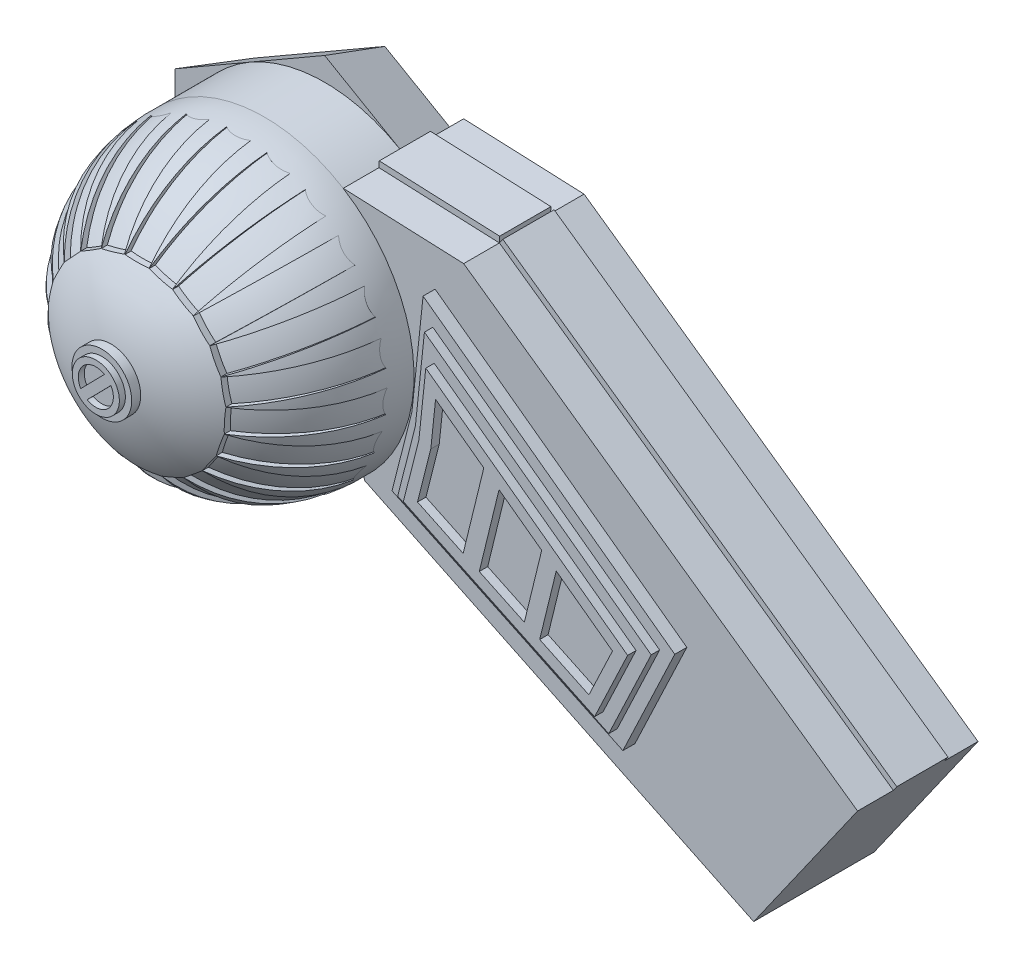
from build123d import *

# Parameters (mm, degrees)
BOSS_EXTRUDE8_DEPTH       = 25.4
SKETCH8_R                 = 31.562311244
BOSS_EXTRUDE4_DEPTH       = 12.7
SKETCH9_R                 = 6.296860476
BOSS_EXTRUDE5_DEPTH       = 59.69
SKETCH10_R                = 4.966059603
BOSS_EXTRUDE6_DEPTH       = 1.27
CUT_EXTRUDE3_REACH        = 176.634
CUT_EXTRUDE3_START_RADIUS = 31.594486539
CUT_EXTRUDE3_END_RADIUS   = 31.594486539
CIRPATTERN8_COUNT         = 23
CIRPATTERN8_ANGLE         = 344
SKETCH13_W                = 101.6
SKETCH13_H                = 10.805663742
BOSS_EXTRUDE9_DEPTH       = 1.27
BOSS_EXTRUDE10_DEPTH      = 2.54
BOSS_EXTRUDE11_DEPTH      = 1.778
BOSS_EXTRUDE12_DEPTH      = 1.778
SKETCH17_W                = 25.419527821
SKETCH17_H                = 10.805663742
BOSS_EXTRUDE13_DEPTH      = 1.27


# Read off the part's stored shape, not the designer's step: Dome2
with BuildPart() as part:
    # Sketch7 → Loft2 section 0
    with BuildSketch(Plane.XY.offset(12.7)):
        with BuildLine():
            Line((0, 36.445017786), (-31.562311244, 18.222508893))
            Line((-31.562311244, 18.222508893), (-31.562311244, -18.222508893))
            Line((-31.562311244, -18.222508893), (0, -36.445017786))
            Line((0, -36.445017786), (31.562311244, -18.222508893))
            Line((31.562311244, -18.222508893), (31.562311244, 18.222508893))
            Line((31.562311244, 18.222508893), (0, 36.445017786))
        make_face()
    # Sketch1 → Loft2 section 1
    with BuildSketch(Plane.XY):
        with BuildLine():
            Line((27.49630657, 15.875), (0, 31.75))
            Line((0, 31.75), (-27.49630657, 15.875))
            Line((-27.49630657, 15.875), (-27.49630657, -15.875))
            Line((-27.49630657, -15.875), (0, -31.75))
            Line((0, -31.75), (27.49630657, -15.875))
            Line((27.49630657, -15.875), (27.49630657, 15.875))
        make_face()
    loft()

    # Sketch8 → Boss-Extrude4 (add)
    with BuildSketch(Plane.XY.offset(12.7)):
        Circle(SKETCH8_R)
    extrude(amount=BOSS_EXTRUDE4_DEPTH)

    # Dome2 outline → Dome2 (revolve)
    with BuildSketch(Plane.XZ):
        with BuildLine():
            Line((0, 58.42), (0, 25.399999968))
            Line((0, 25.399999968), (31.562311242, 25.399999968))
            ThreePointArc((31.562311242, 25.399999968), (22.839110606, 48.656377081), (0, 58.42))
        make_face()
    revolve(axis=Axis((0, 0, 0), (0, 0, 1)))

    # Sketch9 → Boss-Extrude5 (add)
    with BuildSketch(Plane.XY):
        Circle(SKETCH9_R)
    extrude(amount=BOSS_EXTRUDE5_DEPTH)

    # Sketch10 → Boss-Extrude6 (add)
    with BuildSketch(Plane.XY.offset(59.69)):
        Circle(SKETCH10_R)
        with BuildLine():
            Line((1.821452192, 3.219670483), (-3.187259111, -1.877590334))
            ThreePointArc((-3.187259111, -1.877590334), (-2.638536355, 2.592699753), (1.821452192, 3.219670483))
        make_face(mode=Mode.SUBTRACT)
        with BuildLine():
            Line((3.187259111, 1.877590334), (-1.821452192, -3.219670483))
            ThreePointArc((-1.821452192, -3.219670483), (2.638536355, -2.592699753), (3.187259111, 1.877590334))
        make_face(mode=Mode.SUBTRACT)
    extrude(amount=BOSS_EXTRUDE6_DEPTH)

    # Cut-Extrude3: from a sphere face, 176.634 long prism both ways, kept between that surface and its translate by the depth
    cut_extrude3_start = Location((0, 0, 26.825513461)) * Sphere(CUT_EXTRUDE3_START_RADIUS, mode=Mode.PRIVATE)
    cut_extrude3_end = Location((0, 0, 25.555513461)) * Sphere(CUT_EXTRUDE3_END_RADIUS, mode=Mode.PRIVATE)
    # Sketch11 → Cut-Extrude3 (cut, from a surface)
    with BuildSketch(Plane.XY.offset(101.6), mode=Mode.PRIVATE) as cut_extrude3_sk1:
        Polygon((-2.54, 18.591821347), (0, 18.591821347), (2.54, 18.591821347), (2.54, 31.236508203), (-2.54, 31.236508203), align=None)
    cut_extrude3_tool1 = extrude(cut_extrude3_sk1.sketch, amount=CUT_EXTRUDE3_REACH, both=True, mode=Mode.PRIVATE)
    cut_extrude3 = ((cut_extrude3_tool1 & cut_extrude3_start) - cut_extrude3_end).solids().sort_by_distance((0, 24.914165, 40.965631))[0]
    add(cut_extrude3, mode=Mode.SUBTRACT)

    # CirPattern8: Cut-Extrude3 ×23 about axis
    cirpattern8_axis = Axis((0, 0, 0), (0, 0, -1))
    for i in range(1, CIRPATTERN8_COUNT):
        add(cut_extrude3.rotate(cirpattern8_axis, i * CIRPATTERN8_ANGLE / (CIRPATTERN8_COUNT - 1)), mode=Mode.SUBTRACT)



with BuildPart() as body_2:
    # Sketch12 → Boss-Extrude8 (new body)
    with BuildSketch(Plane.XY):
        Polygon((16.632133964, 26.842450764), (42.032133964, 25.785662588), (125.130885893, -32.670794949), (103.209714317, -63.832826922), (21.087138489, -24.270352703), align=None)
    extrude(amount=BOSS_EXTRUDE8_DEPTH)

    # Sketch13 → Boss-Extrude9 (add)
    with BuildSketch(Plane(origin=(26.048612558, 37.029393916, 0), x_dir=(0.8179011016683436, -0.5753588340242201, 0), z_dir=(0.5753588340242201, 0.8179011016683436, 0))):
        with Locations((70.342119913, -12.455754132)):
            Rectangle(SKETCH13_W, SKETCH13_H)
    extrude(amount=BOSS_EXTRUDE9_DEPTH)


with BuildPart() as part_1:
    add(part.part)

    add(body_2.part)  # Boss-Extrude10 merges body 2
    # Sketch14 → Boss-Extrude10 (add)
    with BuildSketch(Plane.XY.offset(25.4)):
        Polygon((36.009736297, 18.111026902), (33.674728804, -4.118244431), (29.471715317, -20.74349778), (78.159330778, -43.851096525), (89.108204582, -20.781864477), align=None)
    extrude(amount=BOSS_EXTRUDE10_DEPTH)

    # Sketch15 → Boss-Extrude11 (add)
    with BuildSketch(Plane.XY.offset(27.94)):
        Polygon((85.913086771, -21.590026907), (38.074152116, 13.450428106), (36.181831064, -4.564468307), (32.445591617, -19.343371007), (76.953731552, -40.467351483), align=None)
    extrude(amount=BOSS_EXTRUDE11_DEPTH)

    # Sketch16 → Boss-Extrude12 (add)
    with BuildSketch(Plane.XY.offset(29.718)):
        Polygon((75.748132325, -37.083606442), (82.717968959, -22.398189336), (40.138567934, 8.789829311), (38.688933324, -5.010692183), (35.419467918, -17.943244233), align=None)
        Polygon((79.522851148, -23.206351766), (67.656289807, -14.514483692), (64.166216975, -28.77516449), (74.542533098, -33.699861401), align=None, mode=Mode.SUBTRACT)
        Polygon((42.202983753, 4.129230515), (41.196035584, -5.456916059), (38.393344218, -16.543117459), (48.022461539, -21.113186813), (52.376447049, -3.322498615), align=None, mode=Mode.SUBTRACT)
        Polygon((55.594708874, -5.679770146), (51.42268186, -22.726963254), (60.925838702, -27.237250583), (64.589316284, -12.268025895), align=None, mode=Mode.SUBTRACT)
    extrude(amount=BOSS_EXTRUDE12_DEPTH)

    # Sketch17 → Boss-Extrude13 (add)
    with BuildSketch(Plane(origin=(1.143613874, 27.486863556, 0), x_dir=(0.9991355993761982, -0.041569869607266614, 0), z_dir=(0.041569869607266614, 0.9991355993761983, 0))):
        with Locations((28.214130819, -12.455754132)):
            Rectangle(SKETCH17_W, SKETCH17_H)
    extrude(amount=BOSS_EXTRUDE13_DEPTH)


solid = part_1.part
